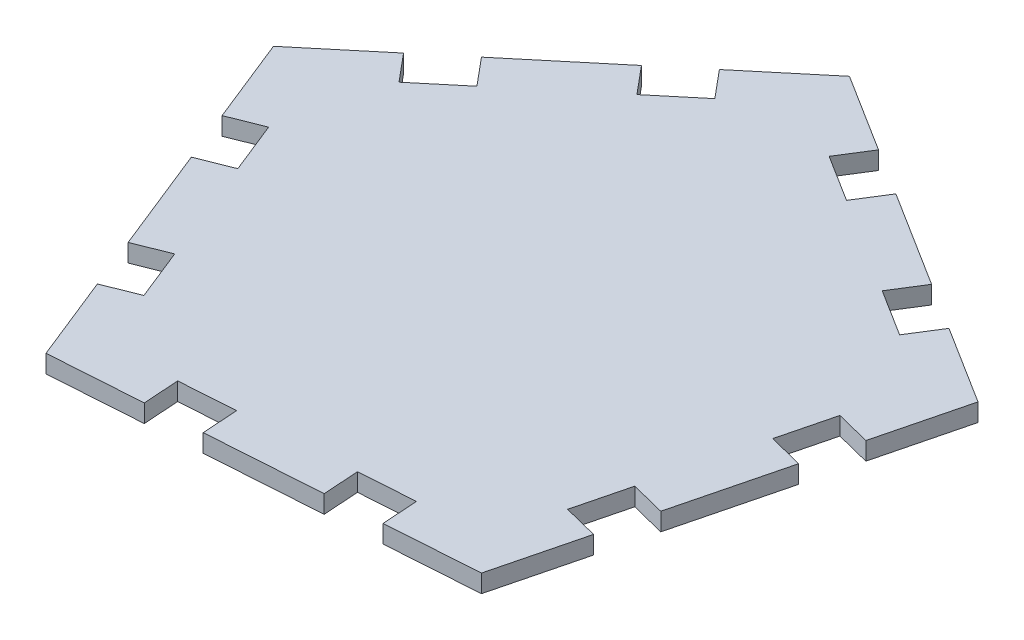
from build123d import *

# Parameters (mm, degrees)
BOSS_EXTRUDE1_DEPTH = 3.18
CUT_F_DEPTH         = 87.044973388
CIRCLE_F_COUNT      = 5


with BuildPart() as part:
    # Sketch1 → Boss-Extrude1 (new body)
    with BuildSketch(Plane(origin=(0, 0, 0), x_dir=(1, 0, 0), z_dir=(0, 1, 0))):
        Polygon((-59.925822748, 15.118064705), (-32.896231583, -52.321105303), (39.594833528, -47.454286112), (57.367184482, 22.992743574), (-4.139963679, 61.664583135), align=None)
    extrude(amount=BOSS_EXTRUDE1_DEPTH)

    # Sketch2 → Cut F (cut, through all)
    with BuildSketch(Plane.XZ):
        Polygon((-53.821872853, 0.111367076), (-47.918390197, -2.254746306), (-44.261331307, 6.869661635), (-50.164813962, 9.235775017), align=None)
        Polygon((-42.657240369, 27.967265581), (-39.000181479, 37.091673522), (-33.096698823, 34.72556014), (-36.753757714, 25.601152199), align=None)
    cut_f = extrude(amount=-CUT_F_DEPTH, mode=Mode.SUBTRACT)

    # Circle F: Cut F ×5 about axis
    circle_f_axis = Axis((0, 3.339, 0), (0, -1, 0))
    for i in range(1, CIRCLE_F_COUNT):
        add(cut_f.rotate(circle_f_axis, i * 360 / CIRCLE_F_COUNT), mode=Mode.SUBTRACT)


solid = part.part
